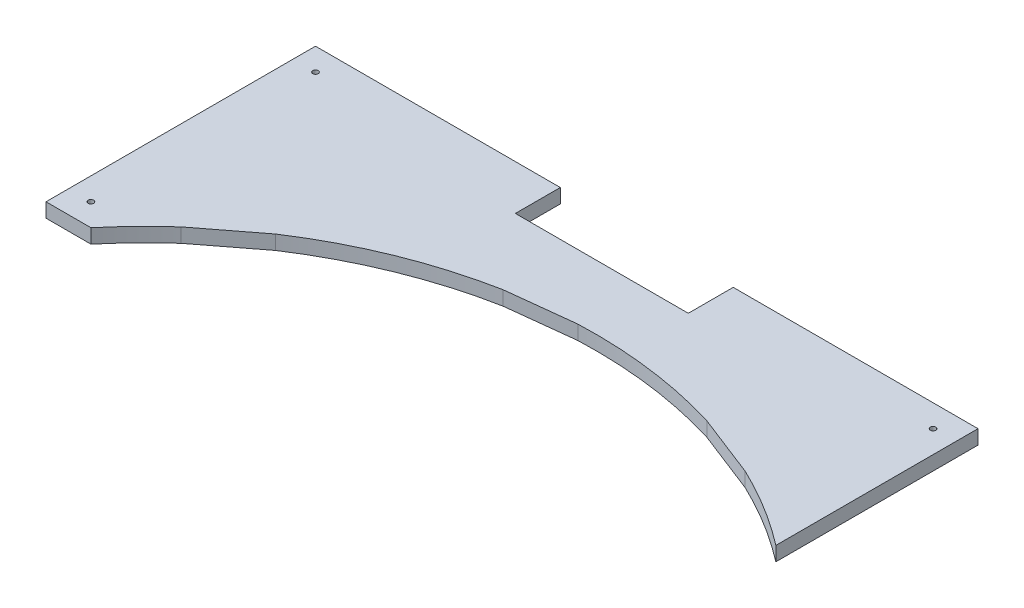
from build123d import *

# Parameters (mm, degrees)
SKETCH1_R           = 1.225
BOSS_EXTRUDE1_DEPTH = 6.35
SKETCH3_W           = 77
SKETCH3_H           = 20
CUT_EXTRUDE7_DEPTH  = 319.536218506


with BuildPart() as part:
    # Sketch1 → Boss-Extrude1 (new body)
    with BuildSketch(Plane(origin=(0, 0, 0), x_dir=(1, 0, 0), z_dir=(0, 1, 0))):
        with BuildLine():
            Line((20, 0), (0, 0))
            Line((0, 0), (0, 120))
            Line((0, 120), (295, 120))
            Line((295, 120), (295, 30))
            ThreePointArc((295, 30), (277.869472669, 41.795014396), (259.606640395, 51.747214585))
            Line((259.606640395, 51.747214585), (231.608714957, 62.662522706))
            ThreePointArc((231.608714957, 62.662522706), (198.986419097, 69.718105487), (165.645037238, 71.250323254))
            Line((165.645037238, 71.250323254), (135.63718091, 67.839149142))
            ThreePointArc((135.63718091, 67.839149142), (98.164426543, 56.795983024), (63.553293355, 38.67891104))
            Line((63.553293355, 38.67891104), (39.760883022, 20.398448087))
            ThreePointArc((39.760883022, 20.398448087), (29.517905027, 10.550429244), (20, 0))
        make_face()
        with Locations((10, 110)):
            Circle(SKETCH1_R, mode=Mode.SUBTRACT)
        with Locations((10, 10)):
            Circle(SKETCH1_R, mode=Mode.SUBTRACT)
        with Locations((285, 110)):
            Circle(SKETCH1_R, mode=Mode.SUBTRACT)
    extrude(amount=BOSS_EXTRUDE1_DEPTH)

    # Sketch3 → Cut-Extrude7 (cut, through all)
    with BuildSketch(Plane(origin=(0, 6.35, 0), x_dir=(1, 0, 0), z_dir=(0, 1, 0))):
        with Locations((147.5, 110)):
            Rectangle(SKETCH3_W, SKETCH3_H)
    extrude(amount=-CUT_EXTRUDE7_DEPTH, mode=Mode.SUBTRACT)


solid = part.part
